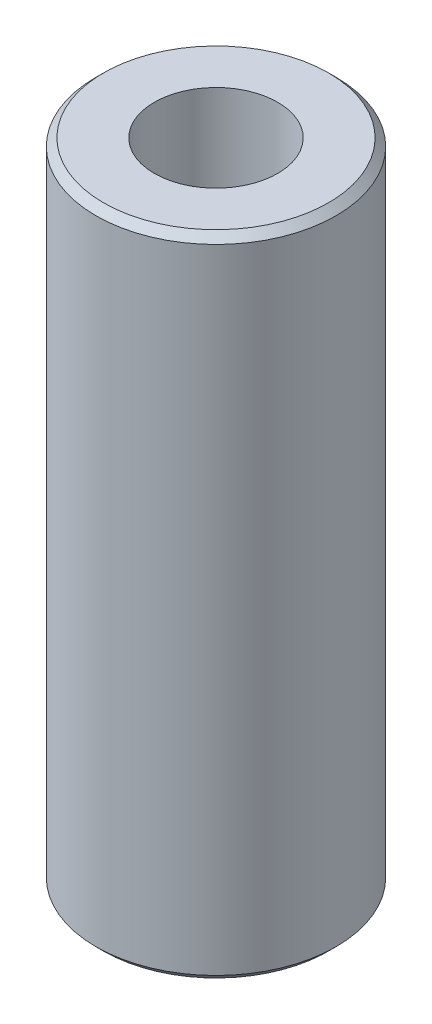
from build123d import *

# Parameters (mm, degrees)
CROQUIS2_R                = 6.35
SALIENTE_EXTRUIR1_DEPTH   = 17.145
CHAFL_N1_SIZE             = 0.396875
CLEARANCE_HOLE_DEPTH      = 20.354483331
CLEARANCE_HOLE_DEPTH_BACK = 20.354483331
CROQUIS4_R                = 3.2639


with BuildPart() as part:
    # Croquis2 → Saliente-Extruir1 (new, symmetric)
    with BuildSketch(Plane(origin=(0, 0, 0), x_dir=(1, 0, 0), z_dir=(0, 1, 0))):
        Circle(CROQUIS2_R)
    extrude(amount=SALIENTE_EXTRUIR1_DEPTH, both=True)

    # Chaflán1
    chafl_n1_edges = [part.edges().sort_by_distance(p)[0] for p in [
        (-6.35, -17.145, 0),
        (-6.35, 17.145, 0),
    ]]
    chamfer(chafl_n1_edges, length=CHAFL_N1_SIZE)

    # Croquis4 → Clearance Hole (cut, two sides: drawn at the far end of the back side and taken through both)
    with BuildSketch(Plane(origin=(0, 0, 0), x_dir=(1, 0, 0), z_dir=(0, 1, 0)).offset(-CLEARANCE_HOLE_DEPTH_BACK)):
        Circle(CROQUIS4_R)
    extrude(amount=CLEARANCE_HOLE_DEPTH + CLEARANCE_HOLE_DEPTH_BACK, mode=Mode.SUBTRACT)


solid = part.part
